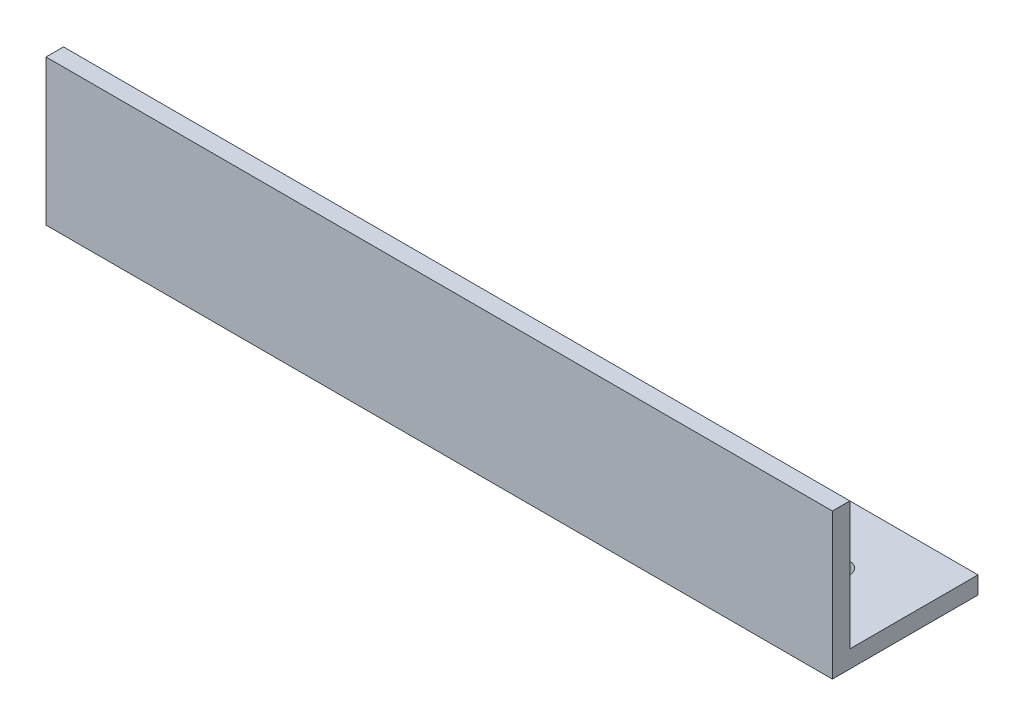
from build123d import *

# Parameters (mm, degrees)
EXTRUDE_2_DEPTH     = 270
SKETCH_2_R          = 4
CUT_EXTRUDE_1_DEPTH = 280.105714739


with BuildPart() as part:
    # Эскиз1 → Вытянуть-Тонкостенный2 (new body)
    with BuildSketch(Plane(origin=(0, 0, 0), x_dir=(0, 0, -1), z_dir=(1, 0, 0))):
        Polygon((0, 50), (0, 0), (50, 0), (50, 6), (6, 6), (6, 50), align=None)
    extrude(amount=EXTRUDE_2_DEPTH)

    # Эскиз2 → Вырез-Вытянуть1 (cut, through all)
    with BuildSketch(Plane.XZ):
        with Locations((26, -28)):
            Circle(SKETCH_2_R)
        with Locations((244, -28)):
            Circle(SKETCH_2_R)
    extrude(amount=-CUT_EXTRUDE_1_DEPTH, mode=Mode.SUBTRACT)


solid = part.part
